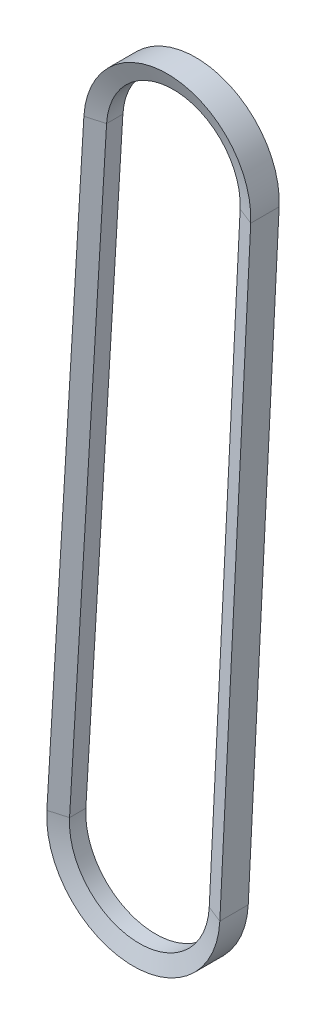
from build123d import *


with BuildPart() as part:
    # Sweep1: sweep along a path in Sketch2
    with BuildLine(Plane.XY) as sweep1_path:
        Line((27.965240654, -1.394745551), (17.604399655, -209.134007893))
        ThreePointArc((17.604399655, -209.134007893), (-12.973924194, -236.670260798), (-40.359067701, -205.956533761))
        Line((-40.359067701, -205.956533761), (-27.950126676, 1.670454675))
        ThreePointArc((-27.950126676, 1.670454675), (1.532618744, 27.958023531), (27.965240654, -1.394745551))
    # Sketch3 → Sweep1 (sweep)
    with BuildSketch(Plane(origin=(27.965240654, -1.394745551, 0), x_dir=(-0.9987585947931866, 0.04981234110879917, 0), z_dir=(-0.04981234110879916, -0.9987585947931865, 0))):
        Polygon((0, 4.7625), (0, -4.7625), (5.588, -2.728634331), (5.588, 2.728634331), align=None)
    sweep(path=sweep1_path.line)


solid = part.part
